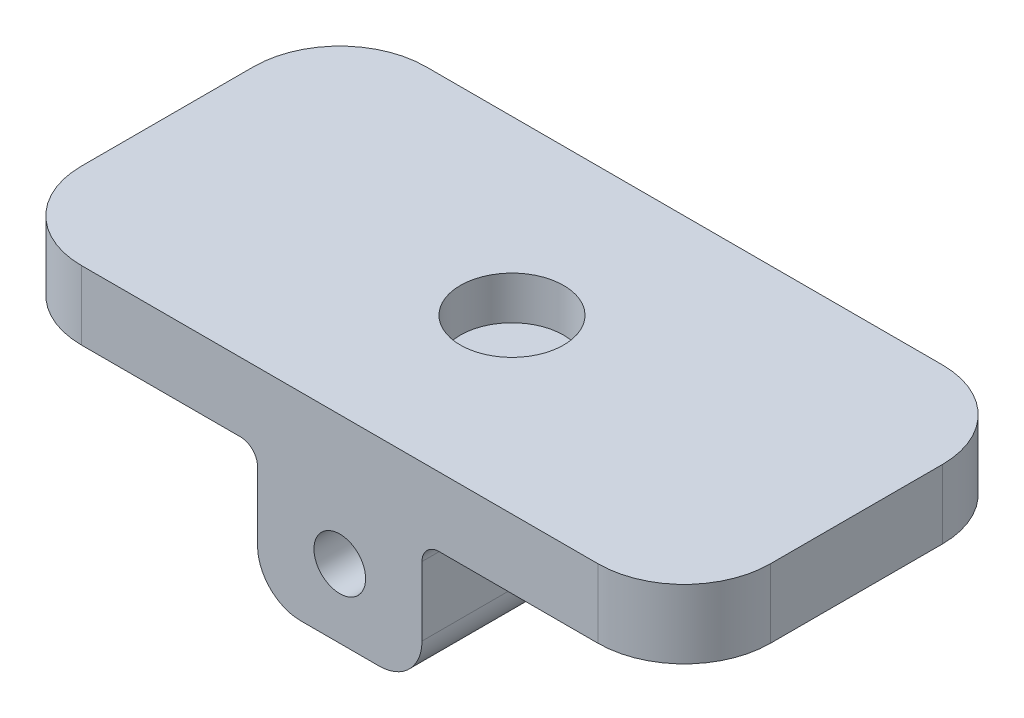
from build123d import *

# Parameters (mm, degrees)
SKETCH1_R           = 3
BOSS_EXTRUDE1_DEPTH = 40
SKETCH2_R           = 1.5
CUT_EXTRUDE1_DEPTH  = 20
SKETCH6_W           = 80
SKETCH6_H           = 4
CUT_EXTRUDE4_DEPTH  = 15
FILLET1_R           = 10
FILLET2_R           = 5
FILLET3_R           = 2
SKETCH7_R           = 6
CUT_EXTRUDE5_DEPTH  = 5


with BuildPart() as part:
    # Sketch1 → Boss-Extrude1 (new body)
    with BuildSketch(Plane.XY):
        Polygon((40, 0), (-40, 0), (-40, -8), (-9.545454545, -8), (-9.545454545, -23), (9.545454545, -23), (9.545454545, -8), (40, -8), align=None)
        with Locations((0, -15)):
            Circle(SKETCH1_R, mode=Mode.SUBTRACT)
    extrude(amount=BOSS_EXTRUDE1_DEPTH)

    # Sketch2 → Cut-Extrude1 (cut)
    with BuildSketch(Plane(origin=(0, 0, 0), x_dir=(-1, 0, 0), z_dir=(0, 0, -1))):
        with Locations((32, -4)):
            Circle(SKETCH2_R)
    extrude(amount=-CUT_EXTRUDE1_DEPTH, mode=Mode.SUBTRACT)

    # Sketch6 → Cut-Extrude4 (cut)
    with BuildSketch(Plane.XZ.offset(23)):
        with Locations((0, 20)):
            Rectangle(SKETCH6_W, SKETCH6_H)
    extrude(amount=-CUT_EXTRUDE4_DEPTH, mode=Mode.SUBTRACT)

    # Fillet1
    # the kernel refuses this fillet: 10 mm, written as the material it takes off along each edge
    with BuildSketch(Plane(origin=(40, -33, 40), x_dir=(-1, 0, 0), z_dir=(0, 1, 0)), Plane(origin=(-40, 25, 40), x_dir=(1, 0, 0), z_dir=(0, -1, 0))) as fillet1_piece_1:
        with BuildLine():
            CenterArc((FILLET1_R, -FILLET1_R), FILLET1_R, 90, 90)
            Line((0, -FILLET1_R), (0, 0))
            Line((0, 0), (FILLET1_R, 0))
        make_face()
    extrude(amount=58, mode=Mode.SUBTRACT)
    with BuildSketch(Plane(origin=(-40, 25, 0), x_dir=(1, 0, 0), z_dir=(0, -1, 0)), Plane(origin=(40, -33, 0), x_dir=(-1, 0, 0), z_dir=(0, 1, 0))) as fillet1_piece_2:
        with BuildLine():
            CenterArc((FILLET1_R, FILLET1_R), FILLET1_R, 180, 90)
            Line((0, FILLET1_R), (0, 0))
            Line((0, 0), (FILLET1_R, 0))
        make_face()
    extrude(amount=58, mode=Mode.SUBTRACT)

    # Fillet2
    fillet2_edges = [part.edges().sort_by_distance(p)[0] for p in [
        (9.545454545, -23, 31),
        (-9.545454545, -23, 31),
        (9.545454545, -23, 9),
        (-9.545454545, -23, 9),
    ]]
    fillet(fillet2_edges, radius=FILLET2_R)

    # Fillet3
    fillet3_edges = [part.edges().sort_by_distance(p)[0] for p in [
        (9.545454545, -8, 31),
        (-9.545454545, -8, 31),
        (9.545454545, -8, 9),
        (-9.545454545, -8, 9),
    ]]
    fillet(fillet3_edges, radius=FILLET3_R)

    # Sketch7 → Cut-Extrude5 (cut)
    with BuildSketch(Plane(origin=(0, 0, 0), x_dir=(1, 0, 0), z_dir=(0, 1, 0))):
        with Locations(Location((0, -20, 0), (0, 0, 180))):
            Circle(SKETCH7_R)
    extrude(amount=-CUT_EXTRUDE5_DEPTH, mode=Mode.SUBTRACT)


solid = part.part
